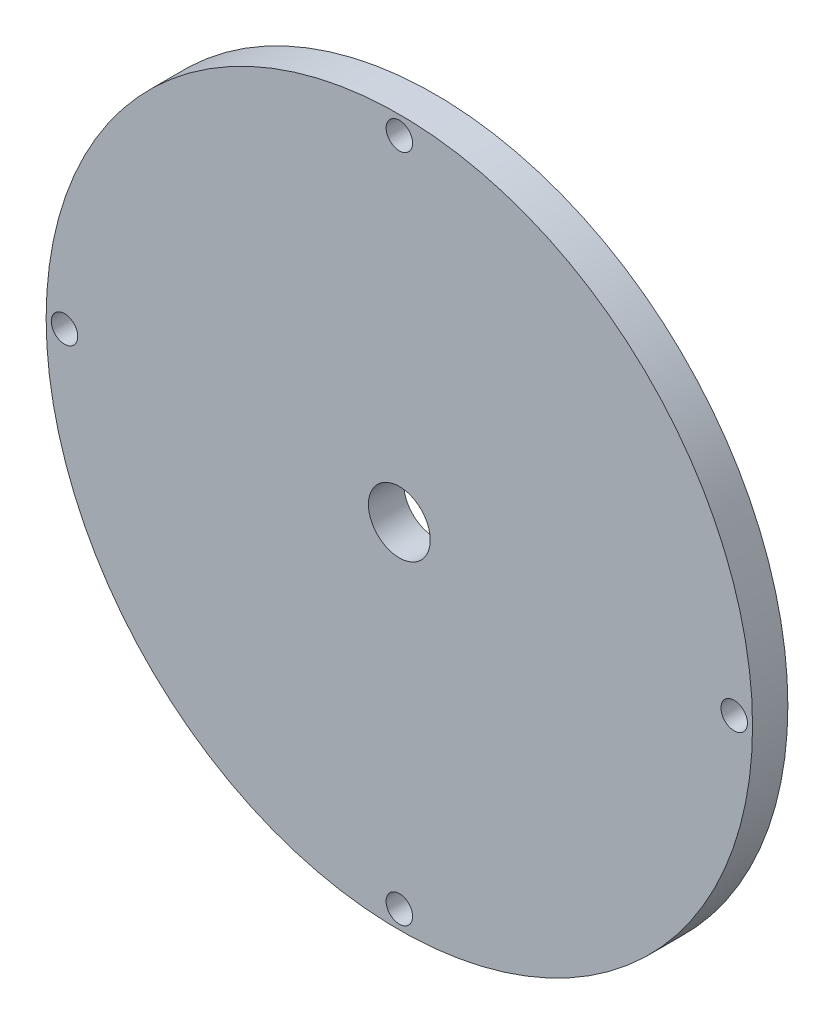
from build123d import *

# Parameters (mm, degrees)
SKETCH1_R           = 63.5
BOSS_EXTRUDE1_DEPTH = 6.35
SKETCH2_R           = 57.15
SKETCH2_R_2         = 50.8
CUT_EXTRUDE1_DEPTH  = 1.27
SKETCH4_R           = 2.38125
CUT_EXTRUDE2_DEPTH  = 91.02678768
SKETCH6_R           = 5.55625
CUT_EXTRUDE4_DEPTH  = 91.02678768


with BuildPart() as part:
    # Sketch1 → Boss-Extrude1 (new body)
    with BuildSketch(Plane.XY):
        Circle(SKETCH1_R)
    extrude(amount=BOSS_EXTRUDE1_DEPTH)

    # Sketch2 → Cut-Extrude1 (cut)
    with BuildSketch(Plane(origin=(0, 0, 0), x_dir=(-1, 0, 0), z_dir=(0, 0, -1))):
        Circle(SKETCH2_R)
        Circle(SKETCH2_R_2, mode=Mode.SUBTRACT)
    extrude(amount=-CUT_EXTRUDE1_DEPTH, mode=Mode.SUBTRACT)

    # Sketch4 → Cut-Extrude2 (cut, through all)
    with BuildSketch(Plane(origin=(0, 0, 0), x_dir=(-1, 0, 0), z_dir=(0, 0, -1))):
        with Locations((0, 60.198)):
            Circle(SKETCH4_R)
        with Locations((60.198, 0)):
            Circle(SKETCH4_R)
        with Locations((0, -60.198)):
            Circle(SKETCH4_R)
        with Locations((-60.198, 0)):
            Circle(SKETCH4_R)
    extrude(amount=-CUT_EXTRUDE2_DEPTH, mode=Mode.SUBTRACT)

    # Sketch6 → Cut-Extrude4 (cut, through all)
    with BuildSketch(Plane(origin=(0, 0, 0), x_dir=(-1, 0, 0), z_dir=(0, 0, -1))):
        Circle(SKETCH6_R)
    extrude(amount=-CUT_EXTRUDE4_DEPTH, mode=Mode.SUBTRACT)


solid = part.part
